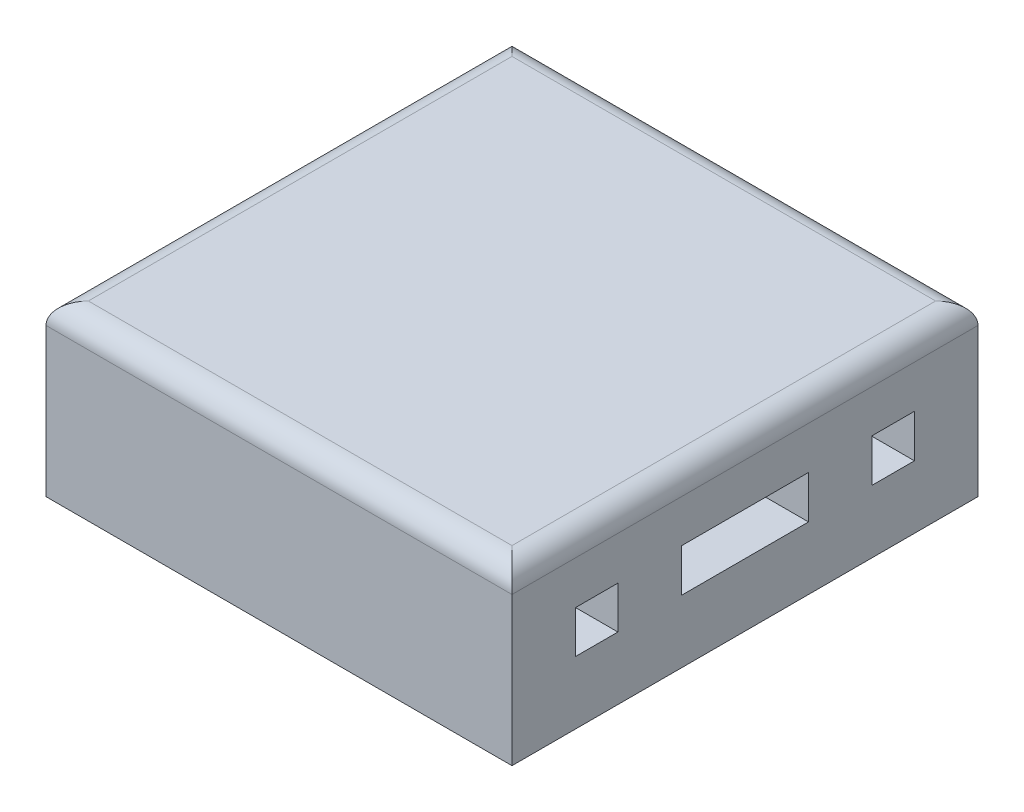
from build123d import *

# Parameters (mm, degrees)
SKETCH2_W               = 11
SKETCH2_H               = 11
BOSS_EXTRUDE1_DEPTH     = 4
CUT_EXTRUDE2_DEPTH      = 9.746427842
CUT_EXTRUDE2_DEPTH_BACK = 9.746427842
SKETCH4_W               = 1
SKETCH4_H               = 1
SKETCH4_W_2             = 3
SKETCH4_H_2             = 1.012866832
CUT_EXTRUDE3_DEPTH      = 2.5
CUT_EXTRUDE3_DEPTH_BACK = 9.746427842
SKETCH5_R               = 2.25
SKETCH8_R               = 1
CUT_EXTRUDE4_DEPTH      = 1
SKETCH8_3_R             = 1
CUT_EXTRUDE5_DEPTH      = 1
FILLET2_R               = 0.5


with BuildPart() as part:
    # Sketch2 → Boss-Extrude1 (new body)
    with BuildSketch(Plane(origin=(0, 0, 0), x_dir=(1, 0, 0), z_dir=(0, 1, 0))):
        Rectangle(SKETCH2_W, SKETCH2_H)
    extrude(amount=BOSS_EXTRUDE1_DEPTH)

    # Sketch4 → Cut-Extrude2 (cut, two sides: drawn at the far end of the back side and taken through both)
    with BuildSketch(Plane(origin=(0, 0, 0), x_dir=(0, 0, -1), z_dir=(1, 0, 0)).offset(-CUT_EXTRUDE2_DEPTH_BACK)):
        with Locations((-3.5, 1.982791405)):
            Rectangle(SKETCH4_W, SKETCH4_H)
        with Locations((0, 1.989224821)):
            Rectangle(SKETCH4_W_2, SKETCH4_H_2)
        with Locations((3.5, 1.989224821)):
            Rectangle(SKETCH4_W, SKETCH4_H_2)
    extrude(amount=CUT_EXTRUDE2_DEPTH + CUT_EXTRUDE2_DEPTH_BACK, mode=Mode.SUBTRACT)

    # Sketch5 → Cut-Extrude3 (cut, two sides: drawn at the far end of the back side and taken through both)
    with BuildSketch(Plane(origin=(0, 0, 0), x_dir=(1, 0, 0), z_dir=(0, 1, 0)).offset(-CUT_EXTRUDE3_DEPTH_BACK)):
        Circle(SKETCH5_R)
    extrude(amount=CUT_EXTRUDE3_DEPTH + CUT_EXTRUDE3_DEPTH_BACK, mode=Mode.SUBTRACT)

    # Sketch8 → Cut-Extrude4 (cut)
    with BuildSketch(Plane(origin=(0, 0, 0), x_dir=(1, 0, 0), z_dir=(0, 1, 0))):
        with Locations((0, -4)):
            Circle(SKETCH8_R)
    extrude(amount=CUT_EXTRUDE4_DEPTH, mode=Mode.SUBTRACT)

    # Sketch8<3> → Cut-Extrude5 (cut)
    with BuildSketch(Plane(origin=(0, 0, 0), x_dir=(1, 0, 0), z_dir=(0, 1, 0))):
        with Locations((0, 4)):
            Circle(SKETCH8_3_R)
    extrude(amount=CUT_EXTRUDE5_DEPTH, mode=Mode.SUBTRACT)

    # Fillet2
    fillet2_edges = [part.edges().sort_by_distance(p)[0] for p in [
        (0, 4, 5.5),
        (-5.5, 4, 0),
        (0, 4, -5.5),
        (5.5, 4, 0),
    ]]
    fillet(fillet2_edges, radius=FILLET2_R)


solid = part.part
